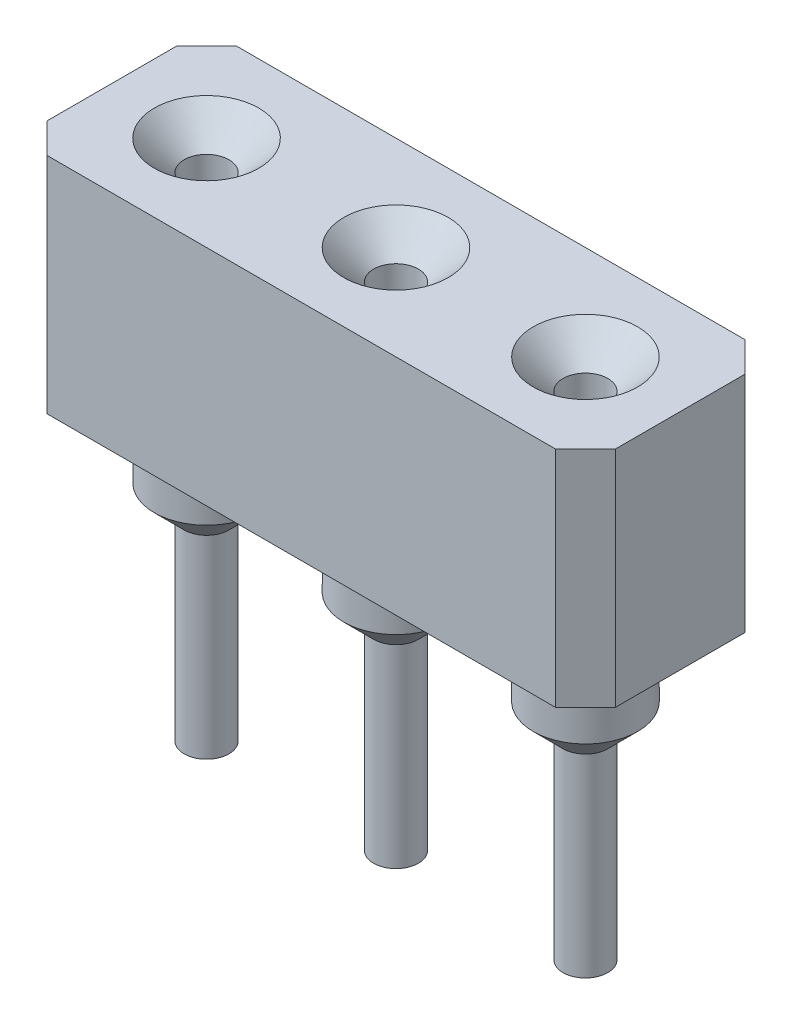
from build123d import *

# Parameters (mm, degrees)
ESQUISSE1_W             = 7.62
ESQUISSE1_H             = 2.54
BOSS_EXTRU_1_DEPTH      = 3
ESQUISSE2_R             = 0.3
ENL_V_MAT_EXTRU_1_DEPTH = 2
ESQUISSE3_R             = 0.7
BOSS_EXTRU_2_DEPTH      = 1
ESQUISSE4_R             = 0.3
BOSS_EXTRU_3_DEPTH      = 3
CHANFREIN1_SIZE         = 0.4


with BuildPart() as part:
    # Esquisse1 → Boss.-Extru.1 (new body)
    with BuildSketch(Plane(origin=(0, 0, 0), x_dir=(1, 0, 0), z_dir=(0, 1, 0))):
        Rectangle(ESQUISSE1_W, ESQUISSE1_H)
    extrude(amount=BOSS_EXTRU_1_DEPTH)

    # Esquisse2 → Enlèv. mat.-Extru.1 (cut)
    with BuildSketch(Plane(origin=(0, 3, 0), x_dir=(1, 0, 0), z_dir=(0, 1, 0))):
        with Locations(Location((-2.54, 0, 0), (0, 0, 270))):
            Circle(ESQUISSE2_R)
        with Locations(Location((0, 0, 0), (0, 0, 270))):
            Circle(ESQUISSE2_R)
        with Locations(Location((2.54, 0, 0), (0, 0, 270))):
            Circle(ESQUISSE2_R)
    extrude(amount=-ENL_V_MAT_EXTRU_1_DEPTH, mode=Mode.SUBTRACT)

    # Esquisse3 → Boss.-Extru.2 (add)
    with BuildSketch(Plane(origin=(0, 0, 0), x_dir=(1, 0, 0), z_dir=(0, 1, 0))):
        with Locations(Location((-2.54, 0, 0), (0, 0, 270))):
            Circle(ESQUISSE3_R)
        with Locations(Location((0, 0, 0), (0, 0, 270))):
            Circle(ESQUISSE3_R)
        with Locations(Location((2.54, 0, 0), (0, 0, 270))):
            Circle(ESQUISSE3_R)
    extrude(amount=-BOSS_EXTRU_2_DEPTH)

    # Esquisse4 → Boss.-Extru.3 (add)
    with BuildSketch(Plane.XZ.offset(1)):
        with Locations(Location((-2.54, 0, 0), (0, 0, 90))):
            Circle(ESQUISSE4_R)
        with Locations(Location((0, 0, 0), (0, 0, 90))):
            Circle(ESQUISSE4_R)
        with Locations(Location((2.54, 0, 0), (0, 0, 90))):
            Circle(ESQUISSE4_R)
    extrude(amount=BOSS_EXTRU_3_DEPTH)

    # Chanfrein1
    chanfrein1_edges = [part.edges().sort_by_distance(p)[0] for p in [
        (-2.54, 3, -0.3),
        (2.54, 3, -0.3),
        (0, 3, -0.3),
        (-2.54, -1, -0.3),
        (0, -1, -0.3),
        (2.54, -1, -0.3),
        (-3.81, 1.5, -1.27),
        (3.81, 1.5, -1.27),
        (3.81, 1.5, 1.27),
        (-3.81, 1.5, 1.27),
    ]]
    chamfer(chanfrein1_edges, length=CHANFREIN1_SIZE - 0.0001)  # a hair under: the kernel refuses the full size


solid = part.part
